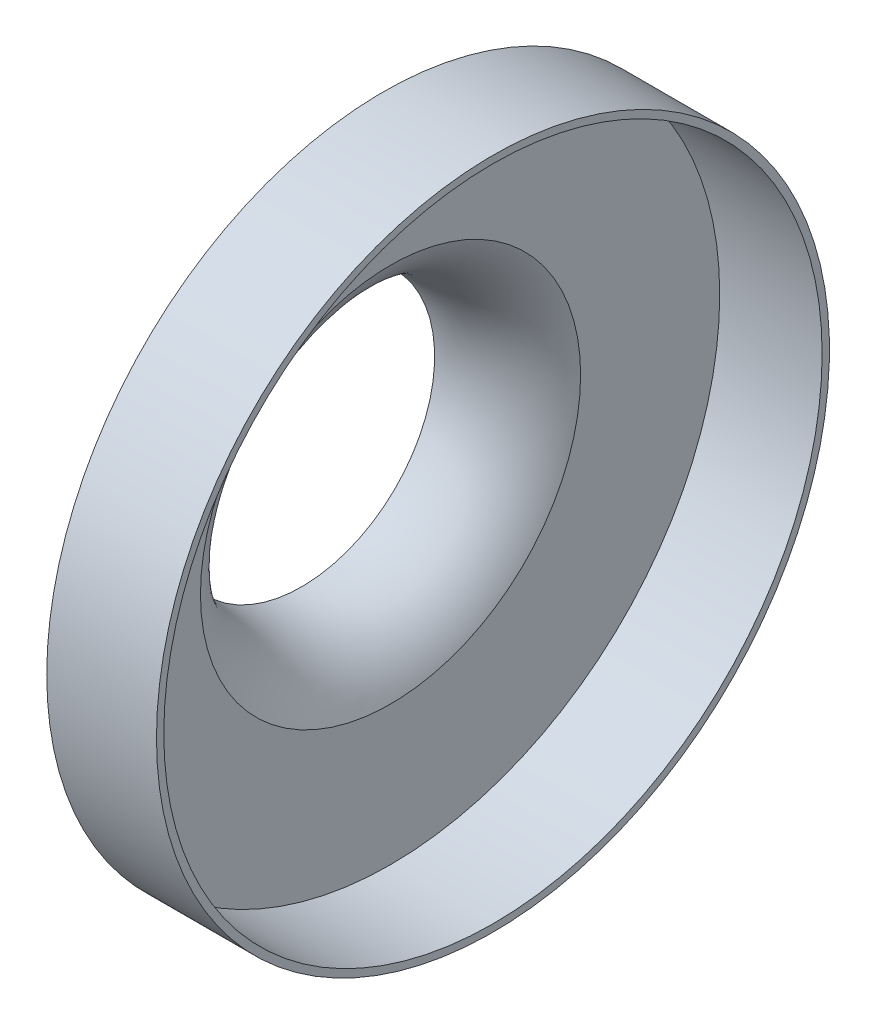
from build123d import *


with BuildPart() as part:
    # Sketch1 → Revolve1 (revolve)
    with BuildSketch(Plane.XY):
        with BuildLine():
            Line((15.446351252, 33.000061), (15.446351252, 57.15))
            Line((15.446351252, 57.15), (33.226351252, 57.15))
            Line((33.226351252, 57.15), (33.226351252, 58.42))
            Line((33.226351252, 58.42), (14.176351252, 58.42))
            Line((14.176351252, 58.42), (14.176351252, 33.283626325))
            ThreePointArc((14.176351252, 33.283626325), (8.372889798, 26.783594579), (0, 24.37003))
            Line((0, 24.37003), (0, 23.10003))
            ThreePointArc((0, 23.10003), (9.1733361, 25.787457832), (15.446351252, 33.000061))
        make_face()
    revolve(axis=Axis((0, 0, 0), (1, 0, 0)))


solid = part.part
